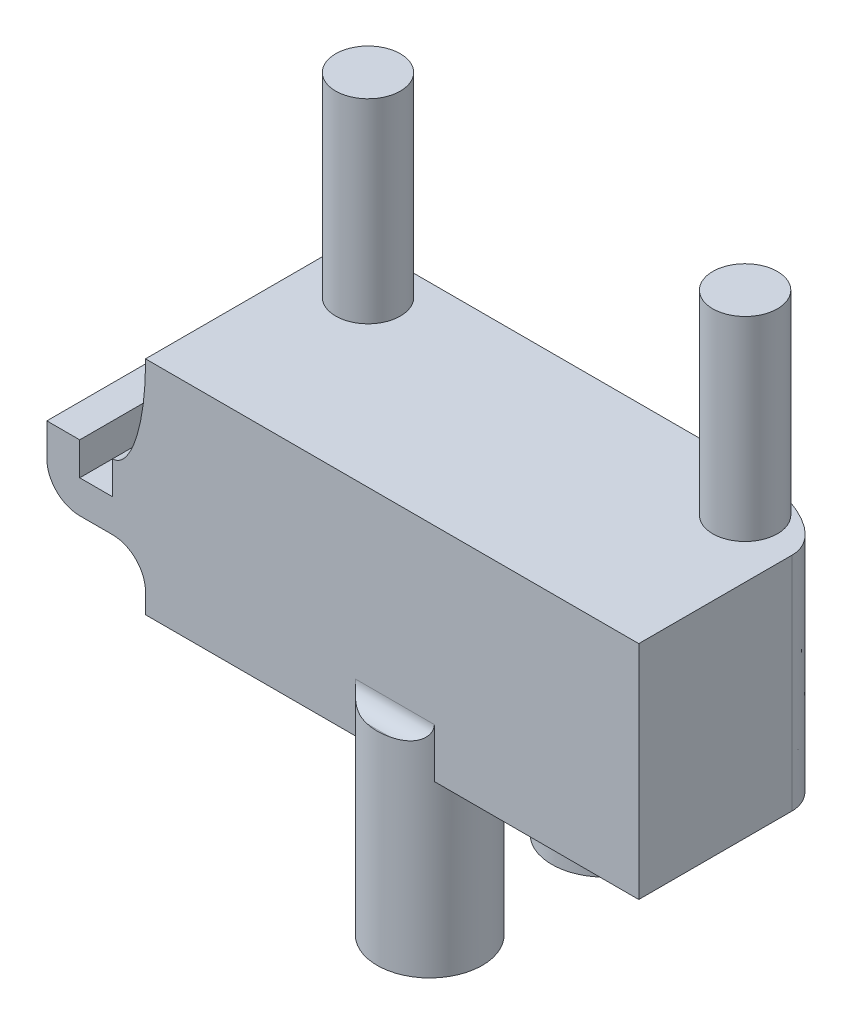
from build123d import *

# Parameters (mm, degrees)
SKETCH1_W                = 22.5
SKETCH1_H                = 7
BOSS_EXTRUDE1_DEPTH      = 1.5
SKETCH2_R                = 1.475
BOSS_EXTRUDE2_DEPTH      = 11.5
BOSS_EXTRUDE4_DEPTH      = 6
BOSS_EXTRUDE4_DEPTH_BACK = 1.5
SKETCH4_W                = 22.5
SKETCH4_H                = 2.5
SKETCH4_H_2              = 7
SKETCH8_W                = 22.5
SKETCH8_H                = 9.5
BOSS_EXTRUDE7_DEPTH      = 2.61
BOSS_EXTRUDE8_DEPTH      = 7.76
BOSS_EXTRUDE8_DEPTH_BACK = 1.5
SKETCH9_R                = 2.4
SKETCH15_W               = 9.5
SKETCH15_H               = 3
BOSS_EXTRUDE11_DEPTH     = 4.5
SKETCH16_W               = 1.5
SKETCH16_H               = 9.5
CUT_EXTRUDE3_DEPTH       = 1.5
FILLET1_SIZE             = 4.5
FILLET1_SIZE_2           = 1.5
FILLET2_R                = 1.5
FILLET3_R                = 1.5
FILLET4_R                = 2
FILLET5_R                = 0.75
FILLET9_SIZE             = 5
FILLET9_SIZE_2           = 2.5


with BuildPart() as part:
    # Sketch1 → Boss-Extrude1 (new body)
    with BuildSketch(Plane(origin=(0, 0, 0), x_dir=(1, 0, 0), z_dir=(0, 1, 0))):
        with Locations((-28.93578967, -21.079480712)):
            Rectangle(SKETCH1_W, SKETCH1_H)
    extrude(amount=BOSS_EXTRUDE1_DEPTH)

    # Sketch2 → Boss-Extrude2 (add)
    with BuildSketch(Plane(origin=(0, 1.5, 0), x_dir=(1, 0, 0), z_dir=(0, 1, 0))):
        with Locations(Location((-37.53578967, -19.579480712, 0), (0, 0, 90))):
            Circle(SKETCH2_R)
        with Locations(Location((-20.33578967, -19.579480712, 0), (0, 0, 90))):
            Circle(SKETCH2_R)
    extrude(amount=BOSS_EXTRUDE2_DEPTH)

    # Sketch4 → Boss-Extrude4 (add, two sides: drawn at the far end of the back side and taken through both)
    with BuildSketch(Plane(origin=(0, 0, 0), x_dir=(-1, 0, 0), z_dir=(0, -1, 0)).offset(-BOSS_EXTRUDE4_DEPTH_BACK)):
        with Locations((28.93578967, -25.829480712)):
            Rectangle(SKETCH4_W, SKETCH4_H)
        with Locations((28.93578967, -21.079480712)):
            Rectangle(SKETCH4_W, SKETCH4_H_2)
    extrude(amount=BOSS_EXTRUDE4_DEPTH + BOSS_EXTRUDE4_DEPTH_BACK)

    # Sketch8 → Boss-Extrude7 (add)
    with BuildSketch(Plane(origin=(0, 1.5, 0), x_dir=(1, 0, 0), z_dir=(0, 1, 0))):
        with Locations((-28.93578967, -22.329480712)):
            Rectangle(SKETCH8_W, SKETCH8_H)
    extrude(amount=BOSS_EXTRUDE7_DEPTH)

    # Sketch9 → Boss-Extrude8 (add, two sides: drawn at the far end of the back side and taken through both)
    with BuildSketch(Plane(origin=(0, -6, 0), x_dir=(-1, 0, 0), z_dir=(0, -1, 0)).offset(-BOSS_EXTRUDE8_DEPTH_BACK)):
        with Locations(Location((28.81078967, -25.489480712, 0), (0, 0, 90))):
            Circle(SKETCH9_R)
        with Locations(Location((28.81078967, -17.519480712, 0), (0, 0, 90))):
            Circle(SKETCH9_R)
    extrude(amount=BOSS_EXTRUDE8_DEPTH + BOSS_EXTRUDE8_DEPTH_BACK)

    # Sketch15 → Boss-Extrude11 (add)
    with BuildSketch(Plane.ZY.offset(40.18578967)):
        with Locations((22.329480712, -2.09)):
            Rectangle(SKETCH15_W, SKETCH15_H)
    extrude(amount=BOSS_EXTRUDE11_DEPTH)

    # Sketch16 → Cut-Extrude3 (cut)
    with BuildSketch(Plane(origin=(0, -0.59, 0), x_dir=(1, 0, 0), z_dir=(0, 1, 0))):
        with Locations((-42.43578967, -22.329480712)):
            Rectangle(SKETCH16_W, SKETCH16_H)
    extrude(amount=-CUT_EXTRUDE3_DEPTH, mode=Mode.SUBTRACT)

    # Fillet1
    # an asymmetric fillet: 4.5, 1.5 mm, written as the material it adds along each edge
    with BuildSketch(Plane(origin=(-40.18578967, -0.59, 27.079480712), x_dir=(0, 1, 0), z_dir=(0, 0, -1))) as fillet1_piece_1:
        with BuildLine():
            Bezier((FILLET1_SIZE, 0), (0, 0), (0, -FILLET1_SIZE_2), weights=[1, 0.707106781, 1])
            Line((0, -FILLET1_SIZE_2), (0, 0))
            Line((0, 0), (FILLET1_SIZE, 0))
        make_face()
    extrude(amount=9.5)

    # Fillet2
    fillet2_edges = [part.edges().sort_by_distance(p)[0] for p in [
        (-44.68578967, -3.59, 22.329480712),
    ]]
    fillet(fillet2_edges, radius=FILLET2_R)

    # Fillet3
    fillet3_edges = [part.edges().sort_by_distance(p)[0] for p in [
        (-40.18578967, -3.59, 22.329480712),
    ]]
    fillet(fillet3_edges, radius=FILLET3_R)

    # Fillet4
    fillet4_edges = [part.edges().sort_by_distance(p)[0] for p in [
        (-28.81078967, -4.5, 17.579480712),
    ]]
    fillet(fillet4_edges, radius=FILLET4_R)

    # Fillet5
    fillet5_edges = [part.edges().sort_by_distance(p)[0] for p in [
        (-28.81078967, -4.5, 27.079480712),
    ]]
    fillet(fillet5_edges, radius=FILLET5_R)

    # Fillet9
    # an asymmetric fillet: 5, 2.5 mm, written as the material it takes off along each edge
    with BuildSketch(Plane(origin=(-17.68578967, 16.61, 17.579480712), x_dir=(-1, 0, 0), z_dir=(0, -1, 0))) as fillet9_piece_1:
        with BuildLine():
            Bezier((FILLET9_SIZE, 0), (0, 0), (0, -FILLET9_SIZE_2), weights=[1, 0.707106781, 1])
            Line((0, -FILLET9_SIZE_2), (0, 0))
            Line((0, 0), (FILLET9_SIZE, 0))
        make_face()
    extrude(amount=35.11, mode=Mode.SUBTRACT)


solid = part.part
